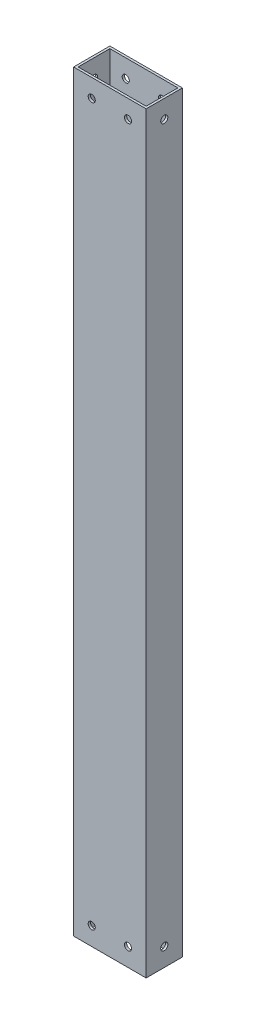
from build123d import *

# Parameters (mm, degrees)
SKETCH1_W               = 50.8
SKETCH1_H               = 527.05
BOSS_EXTRUDE1_DEPTH     = 12.7
SHELL1_T                = -1.5875
CUT_EXTRUDE1_DEPTH      = 266.050703876
CUT_EXTRUDE1_DEPTH_BACK = 266.050703876
SKETCH2_R               = 2.4892
CUT_EXTRUDE2_DEPTH      = 266.050703876
CUT_EXTRUDE2_DEPTH_BACK = 266.050703876
SKETCH3_R               = 2.4892


with BuildPart() as part:
    # Sketch1 → Boss-Extrude1 (new, symmetric)
    with BuildSketch(Plane.XY):
        Rectangle(SKETCH1_W, SKETCH1_H)
    extrude(amount=BOSS_EXTRUDE1_DEPTH, both=True)

    # Shell1
    shell1_openings = [part.faces().sort_by_distance(p)[0] for p in [
        (0, -263.525, 0),
        (0, 263.525, 0),
    ]]
    offset(amount=SHELL1_T, openings=shell1_openings, kind=Kind.INTERSECTION)

    # Sketch2 → Cut-Extrude1 (cut, two sides: drawn at the far end of the back side and taken through both)
    with BuildSketch(Plane.XY.offset(-CUT_EXTRUDE1_DEPTH_BACK)):
        with Locations((-12.7, -250.825)):
            Circle(SKETCH2_R)
        with Locations((12.7, -250.825)):
            Circle(SKETCH2_R)
        with Locations((12.7, 250.825)):
            Circle(SKETCH2_R)
        with Locations((-12.7, 250.825)):
            Circle(SKETCH2_R)
    extrude(amount=CUT_EXTRUDE1_DEPTH + CUT_EXTRUDE1_DEPTH_BACK, mode=Mode.SUBTRACT)

    # Sketch3 → Cut-Extrude2 (cut, two sides: drawn at the far end of the back side and taken through both)
    with BuildSketch(Plane(origin=(0, 0, 0), x_dir=(0, 0, -1), z_dir=(1, 0, 0)).offset(-CUT_EXTRUDE2_DEPTH_BACK)):
        with Locations((0, -250.825)):
            Circle(SKETCH3_R)
        with Locations((0, 250.825)):
            Circle(SKETCH3_R)
    extrude(amount=CUT_EXTRUDE2_DEPTH + CUT_EXTRUDE2_DEPTH_BACK, mode=Mode.SUBTRACT)


solid = part.part
